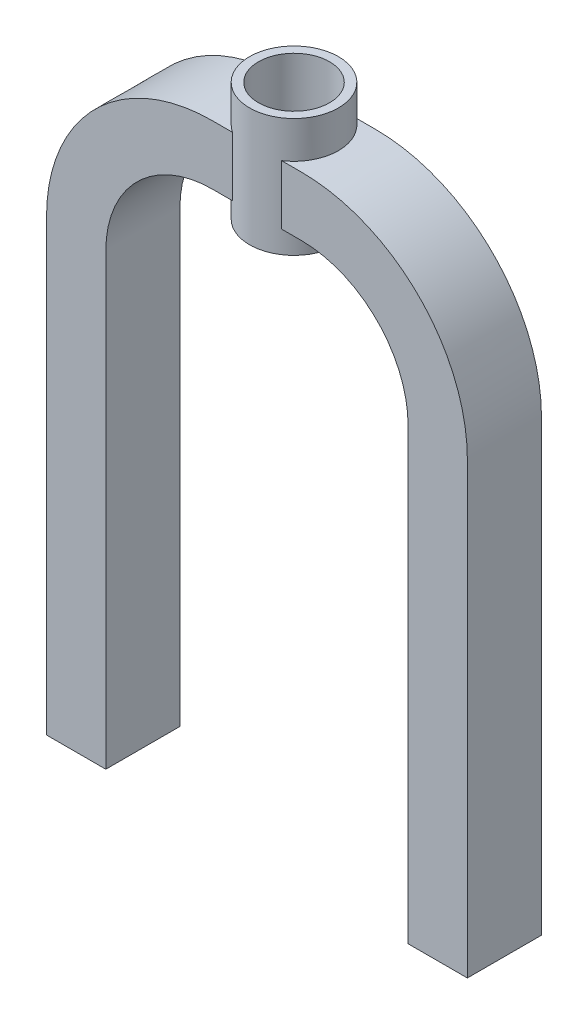
from build123d import *

# Parameters (mm, degrees)
SKETCH1_W          = 15
SKETCH1_H          = 40
SKETCH5_R          = 12
CUT_EXTRUDE1_DEPTH = 232.659232795


with BuildPart() as part:
    # Sketch1 → Revolve1 (revolve)
    with BuildSketch(Plane.XY, mode=Mode.PRIVATE) as revolve1_sk:
        with Locations((7.5, 192)):
            Rectangle(SKETCH1_W, SKETCH1_H)
    revolve(revolve1_sk.sketch.rotate(Axis((0, 150, 0), (0, 1, 0)), 90), axis=Axis((0, 150, 0), (0, 1, 0)))

    # Sweep2: read off the stored shape, not the designer's step
    # Sweep2: loft between two sections, ruled curve by curve
    sweep2_from = [
        Edge.make_bspline([(71, -8, 12.5), (71, -5.333333333, 12.5), (71, -2.666666667, 12.5), (71, 23.916666667, 12.5), (71, 47.833333333, 12.5), (71, 83.708333333, 12.5), (71, 95.666666667, 12.5), (71, 113.604166667, 12.5), (71, 119.583333333, 12.5), (71, 128.552083333, 12.5), (71, 131.541666667, 12.5), (71, 136.026041667, 12.5), (71, 137.520833333, 12.5), (71, 139.763020833, 12.5), (71, 140.510416667, 12.5), (71, 141.631510417, 12.5), (71, 142.005208333, 12.5), (71, 142.565755208, 12.5), (71, 142.752604167, 12.5), (71, 143.126302083, 12.5), (71.000001236, 143.292841375, 12.5), (70.999998755, 143.708621385, 12.5), (70.998594403, 143.958146125, 12.5), (70.992972386, 144.416251287, 12.5), (70.988755964, 144.645284788, 12.5), (70.971891528, 145.332278776, 12.5), (70.955028152, 145.790132872, 12.5), (70.88759179, 147.162870455, 12.5), (70.820169227, 148.076930587, 12.5), (70.550740507, 150.812562727, 12.5), (70.281515056, 152.62758632, 12.5), (69.208896995, 158.020001459, 12.5), (68.139861826, 161.544076942, 12.5), (63.932037809, 171.702662753, 12.5), (59.781343061, 177.914616432, 12.5), (49.414616432, 188.281343061, 12.5), (43.202662753, 192.432037809, 12.5), (33.044076942, 196.639861826, 12.5), (29.520001459, 197.708896995, 12.5), (24.12758632, 198.781515056, 12.5), (22.312562727, 199.050740507, 12.5), (19.576930587, 199.320169227, 12.5), (18.662870455, 199.38759179, 12.5), (17.290132872, 199.455028152, 12.5), (16.832278776, 199.471891528, 12.5), (16.145284788, 199.488755964, 12.5), (15.916251287, 199.492972386, 12.5), (15.458146125, 199.498594403, 12.5), (15.208621385, 199.499998755, 12.5), (14.826766306, 199.500001034, 12.5), (14.6875, 199.5, 12.5), (14.375, 199.5, 12.5), (14.21875, 199.5, 12.5), (13.75, 199.5, 12.5), (13.4375, 199.5, 12.5), (12.5, 199.5, 12.5), (11.875, 199.5, 12.5), (10, 199.5, 12.5), (8.75, 199.5, 12.5), (5, 199.5, 12.5), (2.5, 199.5, 12.5), (0, 199.5, 12.5)], [0, 0, 0, 0, 0.033506923, 0.033506923, 0.334022136, 0.334022136, 0.484279743, 0.484279743, 0.559408547, 0.559408547, 0.596972948, 0.596972948, 0.615755149, 0.615755149, 0.62514625, 0.62514625, 0.6298418, 0.6298418, 0.632189575, 0.632189575, 0.63453735, 0.63453735, 0.636901703, 0.636901703, 0.639266056, 0.639266056, 0.643994762, 0.643994762, 0.653452173, 0.653452173, 0.672366996, 0.672366996, 0.710196643, 0.710196643, 0.785855935, 0.785855935, 0.861515227, 0.861515227, 0.899344874, 0.899344874, 0.918259697, 0.918259697, 0.927717108, 0.927717108, 0.932445814, 0.932445814, 0.934810167, 0.934810167, 0.93717452, 0.93717452, 0.939137816, 0.939137816, 0.941101112, 0.941101112, 0.945027705, 0.945027705, 0.95288089, 0.95288089, 0.96858726, 0.96858726, 1, 1, 1, 1], 3),
        Edge.make_bspline([(51, -8, 12.5), (51, -5.333333333, 12.5), (51, -2.666666667, 12.5), (51, 23.916666667, 12.5), (51, 47.833333333, 12.5), (51, 83.708333333, 12.5), (51, 95.666666667, 12.5), (51, 113.604166667, 12.5), (51, 119.583333333, 12.5), (51, 128.552083333, 12.5), (51, 131.541666667, 12.5), (51, 136.026041667, 12.5), (51, 137.520833333, 12.5), (51, 139.763020833, 12.5), (51, 140.510416667, 12.5), (51, 141.631510417, 12.5), (51, 142.005208333, 12.5), (51, 142.565755208, 12.5), (51, 142.752604167, 12.5), (51, 143.126302083, 12.5), (51.000000795, 143.333460713, 12.5), (50.9999992, 143.667715231, 12.5), (50.999096402, 143.794522509, 12.5), (50.995482248, 144.089018685, 12.5), (50.992771691, 144.236254507, 12.5), (50.981930268, 144.677893499, 12.5), (50.971089526, 144.972228275, 12.5), (50.927737579, 145.854702436, 12.5), (50.884394503, 146.44231252, 12.5), (50.711190326, 148.200933181, 12.5), (50.538116822, 149.367734063, 12.5), (49.84857664, 152.834286653, 12.5), (49.161339746, 155.099763749, 12.5), (46.45631002, 161.630283198, 12.5), (43.788006254, 165.623681992, 12.5), (37.123681992, 172.288006254, 12.5), (33.130283198, 174.95631002, 12.5), (26.599763749, 177.661339746, 12.5), (24.334286652, 178.34857664, 12.5), (20.867734063, 179.038116822, 12.5), (19.700933181, 179.211190326, 12.5), (17.942312521, 179.384394503, 12.5), (17.354702436, 179.427737579, 12.5), (16.472228275, 179.471089526, 12.5), (16.177893499, 179.481930268, 12.5), (15.736254507, 179.492771691, 12.5), (15.589018685, 179.495482248, 12.5), (15.294522509, 179.499096402, 12.5), (15.167715231, 179.4999992, 12.5), (14.860733697, 179.500000665, 12.5), (14.6875, 179.5, 12.5), (14.375, 179.5, 12.5), (14.21875, 179.5, 12.5), (13.75, 179.5, 12.5), (13.4375, 179.5, 12.5), (12.5, 179.5, 12.5), (11.875, 179.5, 12.5), (10, 179.5, 12.5), (8.75, 179.5, 12.5), (5, 179.5, 12.5), (2.5, 179.5, 12.5), (0, 179.5, 12.5)], [0, 0, 0, 0, 0.033506923, 0.033506923, 0.334022136, 0.334022136, 0.484279743, 0.484279743, 0.559408547, 0.559408547, 0.596972948, 0.596972948, 0.615755149, 0.615755149, 0.62514625, 0.62514625, 0.6298418, 0.6298418, 0.632189575, 0.632189575, 0.63453735, 0.63453735, 0.636901703, 0.636901703, 0.639266056, 0.639266056, 0.643994762, 0.643994762, 0.653452173, 0.653452173, 0.672366996, 0.672366996, 0.710196643, 0.710196643, 0.785855935, 0.785855935, 0.861515227, 0.861515227, 0.899344874, 0.899344874, 0.918259697, 0.918259697, 0.927717108, 0.927717108, 0.932445814, 0.932445814, 0.934810167, 0.934810167, 0.93717452, 0.93717452, 0.939137816, 0.939137816, 0.941101112, 0.941101112, 0.945027705, 0.945027705, 0.95288089, 0.95288089, 0.96858726, 0.96858726, 1, 1, 1, 1], 3),
        Edge.make_line((71, -8, 12.5), (51, -8, 12.5)),
        Edge.make_line((0, 179.5, 12.5), (0, 199.5, 12.5)),
    ]
    sweep2_to = [
        Edge.make_bspline([(71, -8, -12.5), (71, -5.333333333, -12.5), (71, -2.666666667, -12.5), (71, 23.916666667, -12.5), (71, 47.833333333, -12.5), (71, 83.708333333, -12.5), (71, 95.666666667, -12.5), (71, 113.604166667, -12.5), (71, 119.583333333, -12.5), (71, 128.552083333, -12.5), (71, 131.541666667, -12.5), (71, 136.026041667, -12.5), (71, 137.520833333, -12.5), (71, 139.763020833, -12.5), (71, 140.510416667, -12.5), (71, 141.631510417, -12.5), (71, 142.005208333, -12.5), (71, 142.565755208, -12.5), (71, 142.752604167, -12.5), (71, 143.126302083, -12.5), (71.000001236, 143.292841375, -12.5), (70.999998755, 143.708621385, -12.5), (70.998594403, 143.958146125, -12.5), (70.992972386, 144.416251287, -12.5), (70.988755964, 144.645284788, -12.5), (70.971891528, 145.332278776, -12.5), (70.955028152, 145.790132872, -12.5), (70.88759179, 147.162870455, -12.5), (70.820169227, 148.076930587, -12.5), (70.550740507, 150.812562727, -12.5), (70.281515056, 152.62758632, -12.5), (69.208896995, 158.020001459, -12.5), (68.139861826, 161.544076942, -12.5), (63.932037809, 171.702662753, -12.5), (59.781343061, 177.914616432, -12.5), (49.414616432, 188.281343061, -12.5), (43.202662753, 192.432037809, -12.5), (33.044076942, 196.639861826, -12.5), (29.520001459, 197.708896995, -12.5), (24.12758632, 198.781515056, -12.5), (22.312562727, 199.050740507, -12.5), (19.576930587, 199.320169227, -12.5), (18.662870455, 199.38759179, -12.5), (17.290132872, 199.455028152, -12.5), (16.832278776, 199.471891528, -12.5), (16.145284788, 199.488755964, -12.5), (15.916251287, 199.492972386, -12.5), (15.458146125, 199.498594403, -12.5), (15.208621385, 199.499998755, -12.5), (14.826766306, 199.500001034, -12.5), (14.6875, 199.5, -12.5), (14.375, 199.5, -12.5), (14.21875, 199.5, -12.5), (13.75, 199.5, -12.5), (13.4375, 199.5, -12.5), (12.5, 199.5, -12.5), (11.875, 199.5, -12.5), (10, 199.5, -12.5), (8.75, 199.5, -12.5), (5, 199.5, -12.5), (2.5, 199.5, -12.5), (0, 199.5, -12.5)], [0, 0, 0, 0, 0.033506923, 0.033506923, 0.334022136, 0.334022136, 0.484279743, 0.484279743, 0.559408547, 0.559408547, 0.596972948, 0.596972948, 0.615755149, 0.615755149, 0.62514625, 0.62514625, 0.6298418, 0.6298418, 0.632189575, 0.632189575, 0.63453735, 0.63453735, 0.636901703, 0.636901703, 0.639266056, 0.639266056, 0.643994762, 0.643994762, 0.653452173, 0.653452173, 0.672366996, 0.672366996, 0.710196643, 0.710196643, 0.785855935, 0.785855935, 0.861515227, 0.861515227, 0.899344874, 0.899344874, 0.918259697, 0.918259697, 0.927717108, 0.927717108, 0.932445814, 0.932445814, 0.934810167, 0.934810167, 0.93717452, 0.93717452, 0.939137816, 0.939137816, 0.941101112, 0.941101112, 0.945027705, 0.945027705, 0.95288089, 0.95288089, 0.96858726, 0.96858726, 1, 1, 1, 1], 3),
        Edge.make_bspline([(51, -8, -12.5), (51, -5.333333333, -12.5), (51, -2.666666667, -12.5), (51, 23.916666667, -12.5), (51, 47.833333333, -12.5), (51, 83.708333333, -12.5), (51, 95.666666667, -12.5), (51, 113.604166667, -12.5), (51, 119.583333333, -12.5), (51, 128.552083333, -12.5), (51, 131.541666667, -12.5), (51, 136.026041667, -12.5), (51, 137.520833333, -12.5), (51, 139.763020833, -12.5), (51, 140.510416667, -12.5), (51, 141.631510417, -12.5), (51, 142.005208333, -12.5), (51, 142.565755208, -12.5), (51, 142.752604167, -12.5), (51, 143.126302083, -12.5), (51.000000795, 143.333460713, -12.5), (50.9999992, 143.667715231, -12.5), (50.999096402, 143.794522509, -12.5), (50.995482248, 144.089018685, -12.5), (50.992771691, 144.236254507, -12.5), (50.981930268, 144.677893499, -12.5), (50.971089526, 144.972228275, -12.5), (50.927737579, 145.854702436, -12.5), (50.884394503, 146.44231252, -12.5), (50.711190326, 148.200933181, -12.5), (50.538116822, 149.367734063, -12.5), (49.84857664, 152.834286653, -12.5), (49.161339746, 155.099763749, -12.5), (46.45631002, 161.630283198, -12.5), (43.788006254, 165.623681992, -12.5), (37.123681992, 172.288006254, -12.5), (33.130283198, 174.95631002, -12.5), (26.599763749, 177.661339746, -12.5), (24.334286652, 178.34857664, -12.5), (20.867734063, 179.038116822, -12.5), (19.700933181, 179.211190326, -12.5), (17.942312521, 179.384394503, -12.5), (17.354702436, 179.427737579, -12.5), (16.472228275, 179.471089526, -12.5), (16.177893499, 179.481930268, -12.5), (15.736254507, 179.492771691, -12.5), (15.589018685, 179.495482248, -12.5), (15.294522509, 179.499096402, -12.5), (15.167715231, 179.4999992, -12.5), (14.860733697, 179.500000665, -12.5), (14.6875, 179.5, -12.5), (14.375, 179.5, -12.5), (14.21875, 179.5, -12.5), (13.75, 179.5, -12.5), (13.4375, 179.5, -12.5), (12.5, 179.5, -12.5), (11.875, 179.5, -12.5), (10, 179.5, -12.5), (8.75, 179.5, -12.5), (5, 179.5, -12.5), (2.5, 179.5, -12.5), (0, 179.5, -12.5)], [0, 0, 0, 0, 0.033506923, 0.033506923, 0.334022136, 0.334022136, 0.484279743, 0.484279743, 0.559408547, 0.559408547, 0.596972948, 0.596972948, 0.615755149, 0.615755149, 0.62514625, 0.62514625, 0.6298418, 0.6298418, 0.632189575, 0.632189575, 0.63453735, 0.63453735, 0.636901703, 0.636901703, 0.639266056, 0.639266056, 0.643994762, 0.643994762, 0.653452173, 0.653452173, 0.672366996, 0.672366996, 0.710196643, 0.710196643, 0.785855935, 0.785855935, 0.861515227, 0.861515227, 0.899344874, 0.899344874, 0.918259697, 0.918259697, 0.927717108, 0.927717108, 0.932445814, 0.932445814, 0.934810167, 0.934810167, 0.93717452, 0.93717452, 0.939137816, 0.939137816, 0.941101112, 0.941101112, 0.945027705, 0.945027705, 0.95288089, 0.95288089, 0.96858726, 0.96858726, 1, 1, 1, 1], 3),
        Edge.make_line((71, -8, -12.5), (51, -8, -12.5)),
        Edge.make_line((0, 179.5, -12.5), (0, 199.5, -12.5)),
    ]
    sweep2 = Solid(Shell([*[Face.make_surface_from_curves(sweep2_from[k], sweep2_to[k]) for k in range(4)], Face(Wire(sweep2_from)), Face(Wire(sweep2_to))]))
    add(sweep2)

    # Mirror1: Sweep2 across plane
    add(sweep2.mirror(Plane(origin=(0, 0, 0), x_dir=(0, 0, 1), z_dir=(1, 0, 0))))

    # Sketch5 → Cut-Extrude1 (cut, through all)
    with BuildSketch(Plane(origin=(0, 212, 0), x_dir=(1, 0, 0), z_dir=(0, 1, 0))):
        with Locations(Location((0, 0, 0), (0, 0, 270))):
            Circle(SKETCH5_R)
    extrude(amount=-CUT_EXTRUDE1_DEPTH, mode=Mode.SUBTRACT)


solid = part.part
